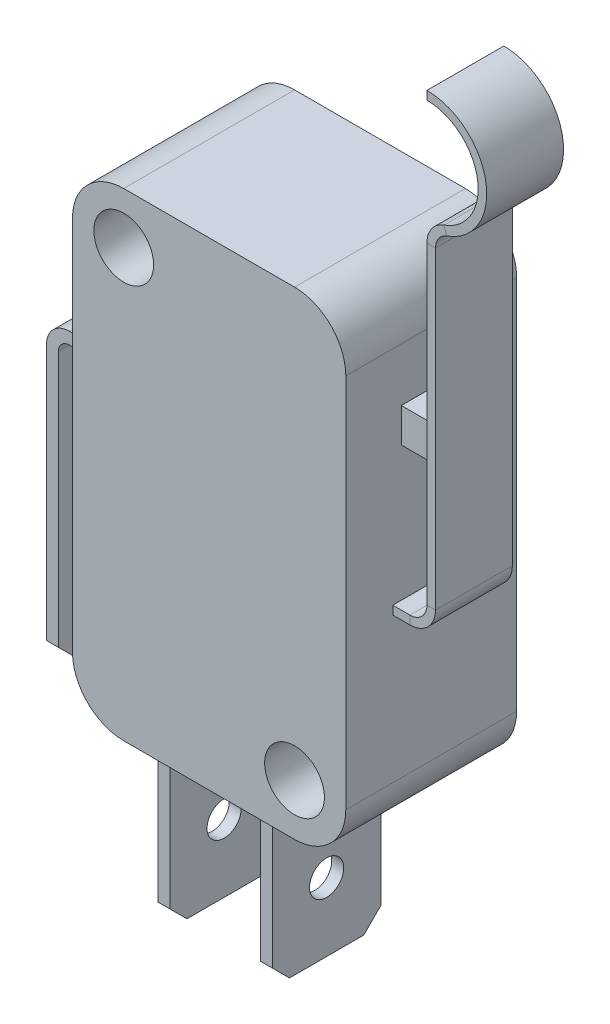
from build123d import *

# Parameters (mm, degrees)
ESBO_O1_W             = 16
ESBO_O1_H             = 28
EXTRUS_O1_DEPTH       = 5
FILETE1_R             = 3
ESBO_O2_R             = 1.75
CORTE_EXTRUS_O1_DEPTH = 34.763886032
FLANGE_BASE1_START    = -2.25
FLANGE_BASE1_DEPTH    = 4.5
EXTRUS_O2_DEPTH       = 1.75
EXTRUS_O_FINA1_DEPTH  = 3.175
ESBO_O6_4_W           = 0.7
ESBO_O6_4_H           = 10
EXTRUS_O_FINA2_DEPTH  = 3.175
ESBO_O6_5_W           = 0.7
ESBO_O6_5_H           = 10
EXTRUS_O_FINA3_DEPTH  = 3.175
CHANFRO1_SIZE         = 1
ESBO_O7_R             = 1
CORTE_EXTRUS_O8_DEPTH = 3.35
ESBO_O7_6_R           = 1
CORTE_EXTRUS_O9_DEPTH = 47.597558949


# Read off the part's stored shape, not the designer's step: Flange-base1
with BuildPart() as part:
    # Esboço1 → Extrusão1 (new, symmetric)
    with BuildSketch(Plane.XY):
        with Locations((8, 14)):
            Rectangle(ESBO_O1_W, ESBO_O1_H)
    extrude(amount=EXTRUS_O1_DEPTH, both=True)

    # Filete1
    filete1_edges = [part.edges().sort_by_distance(p)[0] for p in [
        (0, 28, 0),
        (16, 28, 0),
        (16, 0, 0),
        (0, 0, 0),
    ]]
    fillet(filete1_edges, radius=FILETE1_R)

    # Esboço2 → Corte-extrusão1 (cut, through all)
    with BuildSketch(Plane.XY.offset(5)):
        with Locations((3, 25)):
            Circle(ESBO_O2_R)
        with Locations((13, 3)):
            Circle(ESBO_O2_R)
    extrude(amount=-CORTE_EXTRUS_O1_DEPTH, mode=Mode.SUBTRACT)



with BuildPart() as body_2:
    # Flange-base1 outline → Flange-base1 (new body)
    with BuildSketch(Plane.XY.offset(FLANGE_BASE1_START)):
        with BuildLine():
            ThreePointArc((19.166666667, 32.300168354), (21.449594959, 36.191856925), (18, 39.1))
            Line((18, 39.1), (18, 38.6))
            ThreePointArc((18, 38.6), (20.956795679, 36.107305936), (19, 32.771572875))
            ThreePointArc((19, 32.771572875), (18.275255129, 32.223384717), (18, 31.357359313))
            Line((18, 31.357359313), (18, 13))
            ThreePointArc((18, 13), (17.707106781, 12.292893219), (17, 12))
            Line((17, 12), (16, 12))
            Line((16, 12), (16, 11.5))
            Line((16, 11.5), (17, 11.5))
            ThreePointArc((17, 11.5), (18.060660172, 11.939339828), (18.5, 13))
            Line((18.5, 13), (18.5, 31.357359313))
            ThreePointArc((18.5, 31.357359313), (18.683503419, 31.934709582), (19.166666667, 32.300168354))
        make_face()
    extrude(amount=FLANGE_BASE1_DEPTH)


with BuildPart() as part_1:
    add(part.part)

    add(body_2.part)  # Extrusão2 merges body 2
    # Esboço5 → Extrusão2 (add, symmetric)
    with BuildSketch(Plane.XY):
        with BuildLine():
            Line((16, 21.874244368), (17.5, 21.874244368))
            ThreePointArc((17.5, 21.874244368), (17.853553391, 21.727797759), (18, 21.374244368))
            Line((18, 21.374244368), (18, 20.374244368))
            ThreePointArc((18, 20.374244368), (17.853553391, 20.020690978), (17.5, 19.874244368))
            Line((17.5, 19.874244368), (16, 19.874244368))
            Line((16, 19.874244368), (16, 21.874244368))
        make_face()
    extrude(amount=EXTRUS_O2_DEPTH, both=True)

    # Esboço6 → Extrusão-Fina1 (add, symmetric)
    with BuildSketch(Plane.XY):
        with BuildLine():
            Line((0, 17.35), (-2, 17.35))
            ThreePointArc((-2, 17.35), (-2.954594155, 16.954594155), (-3.35, 16))
            Line((-3.35, 16), (-3.35, 0))
            Line((-3.35, 0), (-2.65, 0))
            Line((-2.65, 0), (-2.65, 16))
            ThreePointArc((-2.65, 16), (-2.459619408, 16.459619408), (-2, 16.65))
            Line((-2, 16.65), (0, 16.65))
            Line((0, 16.65), (0, 17.35))
        make_face()
    extrude(amount=EXTRUS_O_FINA1_DEPTH, both=True)

    # Esboço6<4> → Extrusão-Fina2 (add, symmetric)
    with BuildSketch(Plane.XY):
        with Locations((3.526922814, -5)):
            Rectangle(ESBO_O6_4_W, ESBO_O6_4_H)
    extrude(amount=EXTRUS_O_FINA2_DEPTH, both=True)

    # Esboço6<5> → Extrusão-Fina3 (add, symmetric)
    with BuildSketch(Plane.XY):
        with Locations((3.526922814, -5)):
            Rectangle(ESBO_O6_5_W, ESBO_O6_5_H)
        with BuildLine():
            Line((0, 17.35), (-2, 17.35))
            ThreePointArc((-2, 17.35), (-2.954594155, 16.954594155), (-3.35, 16))
            Line((-3.35, 16), (-3.35, 0))
            Line((-3.35, 0), (-2.65, 0))
            Line((-2.65, 0), (-2.65, 16))
            ThreePointArc((-2.65, 16), (-2.459619408, 16.459619408), (-2, 16.65))
            Line((-2, 16.65), (0, 16.65))
            Line((0, 16.65), (0, 17.35))
        make_face()
        with Locations((9.526922814, -5)):
            Rectangle(ESBO_O6_5_W, ESBO_O6_5_H)
    extrude(amount=EXTRUS_O_FINA3_DEPTH, both=True)

    # Chanfro1
    chanfro1_edges = [part_1.edges().sort_by_distance(p)[0] for p in [
        (-3, 0, -3.175),
        (3.526922814, -10, 3.175),
        (3.526922814, -10, -3.175),
        (9.526922814, -10, 3.175),
        (9.526922814, -10, -3.175),
        (-3, 0, 3.175),
    ]]
    chamfer(chanfro1_edges, length=CHANFRO1_SIZE)

    # Esboço7 → Corte-extrusão8 (cut)
    with BuildSketch(Plane.ZY.offset(3.35)):
        with Locations(Location((0, 4, 0), (0, 0, 270))):
            Circle(ESBO_O7_R)
    extrude(amount=-CORTE_EXTRUS_O8_DEPTH, mode=Mode.SUBTRACT)

    # Esboço7<6> → Corte-extrusão9 (cut, through all)
    with BuildSketch(Plane.ZY.offset(3.35)):
        with Locations(Location((0, -6, 0), (0, 0, 90))):
            Circle(ESBO_O7_6_R)
    extrude(amount=-CORTE_EXTRUS_O9_DEPTH, mode=Mode.SUBTRACT)


solid = part_1.part
